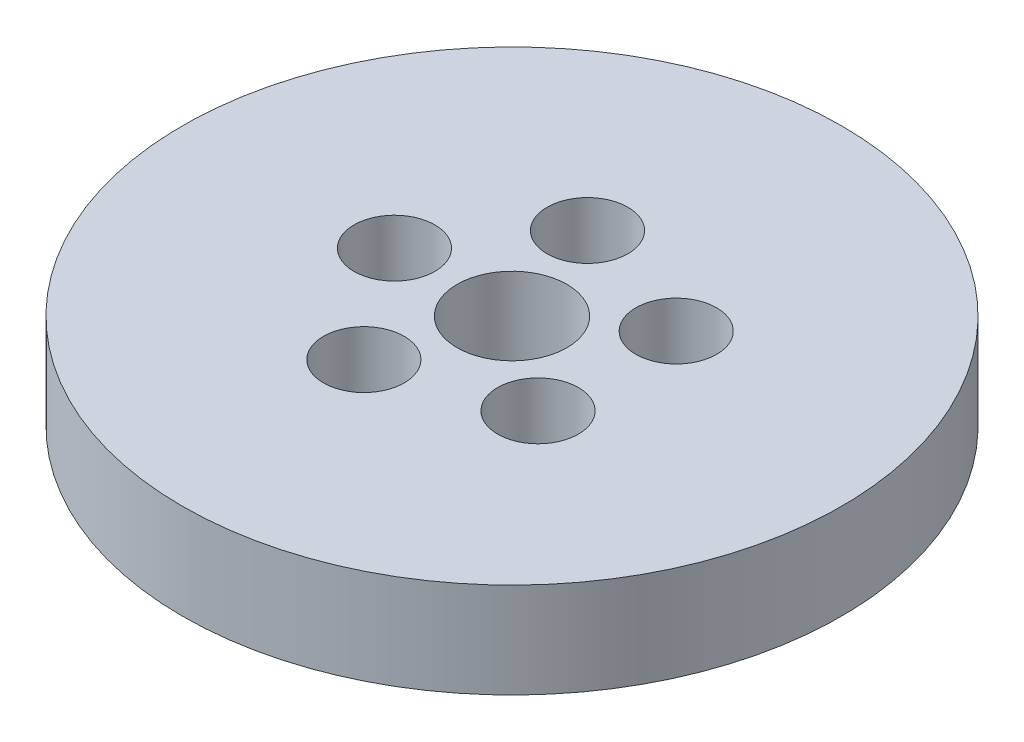
from build123d import *

# Parameters (mm, degrees)
SKETCH1_R           = 45
BOSS_EXTRUDE1_DEPTH = 13
SKETCH2_R           = 7.5
CUT_EXTRUDE1_DEPTH  = 65.953829756
SKETCH3_R           = 5.514749497
CUT_EXTRUDE2_DEPTH  = 8.117252643
CIRPATTERN1_COUNT   = 5


with BuildPart() as part:
    # Sketch1 → Boss-Extrude1 (new body)
    with BuildSketch(Plane(origin=(0, 0, 0), x_dir=(1, 0, 0), z_dir=(0, 1, 0))):
        Circle(SKETCH1_R)
    extrude(amount=BOSS_EXTRUDE1_DEPTH)

    # Sketch2 → Cut-Extrude1 (cut, through all)
    with BuildSketch(Plane(origin=(0, 0, 0), x_dir=(1, 0, 0), z_dir=(0, 1, 0))):
        Circle(SKETCH2_R)
    extrude(amount=CUT_EXTRUDE1_DEPTH, mode=Mode.SUBTRACT)

    # Sketch3 → Cut-Extrude2 (cut)
    with BuildSketch(Plane(origin=(0, 13, 0), x_dir=(1, 0, 0), z_dir=(0, 1, 0))):
        with Locations((-16.053794416, 0)):
            Circle(SKETCH3_R)
    cut_extrude2 = extrude(amount=-CUT_EXTRUDE2_DEPTH, mode=Mode.SUBTRACT)

    # CirPattern1: Cut-Extrude2 ×5 about axis
    cirpattern1_axis = Axis((0, 0, 0), (0, 1, 0))
    for i in range(1, CIRPATTERN1_COUNT):
        add(cut_extrude2.rotate(cirpattern1_axis, i * 360 / CIRPATTERN1_COUNT), mode=Mode.SUBTRACT)


solid = part.part
